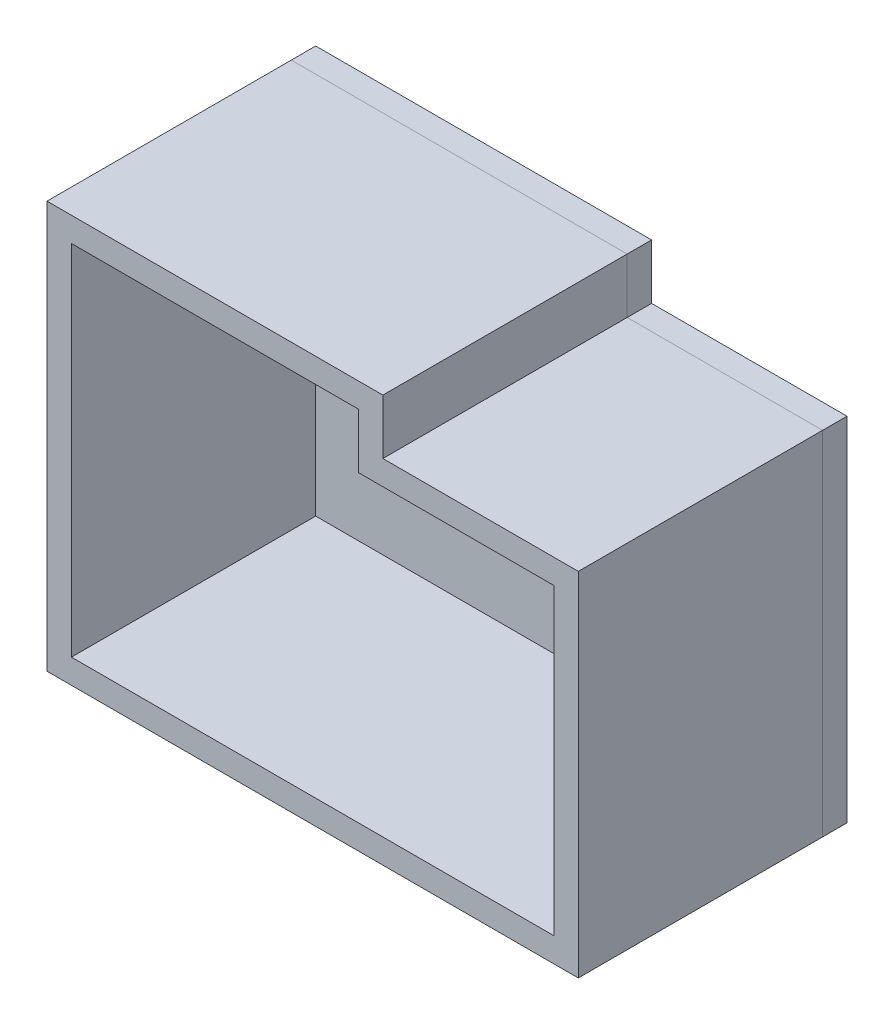
from build123d import *

# Parameters (mm, degrees)
EXTRUDE_THIN2_DEPTH = 3048
BOSS_EXTRUDE1_DEPTH = 304.8


with BuildPart() as part:
    # Sketch1 → Extrude-Thin2 (new body)
    with BuildSketch(Plane.XY):
        Polygon((6324.6, -304.8), (-304.8, -304.8), (-304.8, 4775.2), (3886.2, 4775.2), (3886.2, 4089.4), (6324.6, 4089.4), align=None)
        Polygon((6019.8, 0), (0, 0), (0, 4470.4), (3581.4, 4470.4), (3581.4, 3784.6), (6019.8, 3784.6), align=None, mode=Mode.SUBTRACT)
    extrude(amount=EXTRUDE_THIN2_DEPTH)


with BuildPart() as body_2:
    # Sketch3 → Boss-Extrude1 (new body)
    with BuildSketch(Plane(origin=(0, 0, 0), x_dir=(-1, 0, 0), z_dir=(0, 0, -1))):
        Polygon((304.8, -304.8), (304.8, 4775.2), (-3886.2, 4775.2), (-3886.2, 4089.4), (-6324.6, 4089.4), (-6324.6, -304.8), align=None)
    extrude(amount=BOSS_EXTRUDE1_DEPTH)


solid = Compound([part.part, body_2.part])
